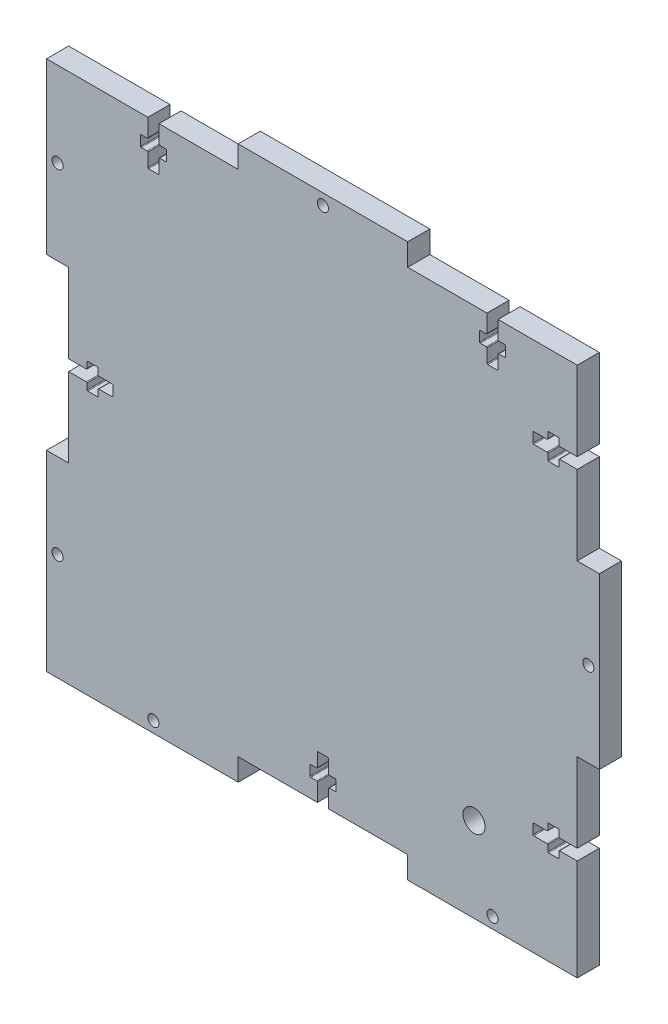
from build123d import *

# Parameters (mm, degrees)
BOX_SIDE_DEPTH       = 6
SKETCH2_R            = 1.5
SCREW_CUT_OUTS_DEPTH = 107.235587258
SKETCH3_R            = 3
CUT_EXTRUDE1_DEPTH   = 107.235587258


with BuildPart() as part:
    # Sketch1 → Box Side (new body)
    with BuildSketch(Plane.XY):
        Polygon((-69, 69), (-23, 69), (-23, 75), (23, 75), (23, 69), (69, 69), (69, 23), (75, 23), (75, -23), (69, -23), (69, -69), (69, -75), (23, -75), (23, -69), (-23, -69), (-23, -75), (-69, -75), (-75, -75), (-75, -69), (-75, -23), (-69, -23), (-69, 23), (-75, 23), (-75, 69), align=None)
    extrude(amount=BOX_SIDE_DEPTH)

    # Sketch2 → Screw Cut-outs (cut, through all)
    with BuildSketch(Plane.XY.offset(6)):
        with Locations((0, 72)):
            Circle(SKETCH2_R)
        with Locations((72, 0)):
            Circle(SKETCH2_R)
        with Locations((-46, -72)):
            Circle(SKETCH2_R)
        with Locations((46, -72)):
            Circle(SKETCH2_R)
        with Locations((-72, 46)):
            Circle(SKETCH2_R)
        with Locations((-72, -46)):
            Circle(SKETCH2_R)
        with BuildLine():
            Line((-44.5, 69), (-44.5, 64.2))
            ThreePointArc((-44.5, 64.2), (-44.441421356, 64.058578644), (-44.3, 64))
            Line((-44.3, 64), (-42.7, 64))
            ThreePointArc((-42.7, 64), (-42.558578644, 63.941421356), (-42.5, 63.8))
            Line((-42.5, 63.8), (-42.5, 61.2))
            ThreePointArc((-42.5, 61.2), (-42.558578644, 61.058578644), (-42.7, 61))
            Line((-42.7, 61), (-44.3, 61))
            ThreePointArc((-44.3, 61), (-44.441421356, 60.941421356), (-44.5, 60.8))
            Line((-44.5, 60.8), (-44.5, 57.2))
            ThreePointArc((-44.5, 57.2), (-44.558578644, 57.058578644), (-44.7, 57))
            Line((-44.7, 57), (-47.3, 57))
            ThreePointArc((-47.3, 57), (-47.441421356, 57.058578644), (-47.5, 57.2))
            Line((-47.5, 57.2), (-47.5, 60.8))
            ThreePointArc((-47.5, 60.8), (-47.558578644, 60.941421356), (-47.7, 61))
            Line((-47.7, 61), (-49.3, 61))
            ThreePointArc((-49.3, 61), (-49.441421356, 61.058578644), (-49.5, 61.2))
            Line((-49.5, 61.2), (-49.5, 63.8))
            ThreePointArc((-49.5, 63.8), (-49.441421356, 63.941421356), (-49.3, 64))
            Line((-49.3, 64), (-47.7, 64))
            ThreePointArc((-47.7, 64), (-47.558578644, 64.058578644), (-47.5, 64.2))
            Line((-47.5, 64.2), (-47.5, 69))
            Line((-47.5, 69), (-44.5, 69))
        make_face()
        with BuildLine():
            Line((47.5, 69), (47.5, 64.2))
            ThreePointArc((47.5, 64.2), (47.558578644, 64.058578644), (47.7, 64))
            Line((47.7, 64), (49.3, 64))
            ThreePointArc((49.3, 64), (49.441421356, 63.941421356), (49.5, 63.8))
            Line((49.5, 63.8), (49.5, 61.2))
            ThreePointArc((49.5, 61.2), (49.441421356, 61.058578644), (49.3, 61))
            Line((49.3, 61), (47.7, 61))
            ThreePointArc((47.7, 61), (47.558578644, 60.941421356), (47.5, 60.8))
            Line((47.5, 60.8), (47.5, 57.2))
            ThreePointArc((47.5, 57.2), (47.441421356, 57.058578644), (47.3, 57))
            Line((47.3, 57), (44.7, 57))
            ThreePointArc((44.7, 57), (44.558578644, 57.058578644), (44.5, 57.2))
            Line((44.5, 57.2), (44.5, 60.8))
            ThreePointArc((44.5, 60.8), (44.441421356, 60.941421356), (44.3, 61))
            Line((44.3, 61), (42.7, 61))
            ThreePointArc((42.7, 61), (42.558578644, 61.058578644), (42.5, 61.2))
            Line((42.5, 61.2), (42.5, 63.8))
            ThreePointArc((42.5, 63.8), (42.558578644, 63.941421356), (42.7, 64))
            Line((42.7, 64), (44.3, 64))
            ThreePointArc((44.3, 64), (44.441421356, 64.058578644), (44.5, 64.2))
            Line((44.5, 64.2), (44.5, 69))
            Line((44.5, 69), (47.5, 69))
        make_face()
        with BuildLine():
            Line((69, 44.5), (64.2, 44.5))
            ThreePointArc((64.2, 44.5), (64.058578644, 44.441421356), (64, 44.3))
            Line((64, 44.3), (64, 42.7))
            ThreePointArc((64, 42.7), (63.941421356, 42.558578644), (63.8, 42.5))
            Line((63.8, 42.5), (61.2, 42.5))
            ThreePointArc((61.2, 42.5), (61.058578644, 42.558578644), (61, 42.7))
            Line((61, 42.7), (61, 44.3))
            ThreePointArc((61, 44.3), (60.941421356, 44.441421356), (60.8, 44.5))
            Line((60.8, 44.5), (57.2, 44.5))
            ThreePointArc((57.2, 44.5), (57.058578644, 44.558578644), (57, 44.7))
            Line((57, 44.7), (57, 47.3))
            ThreePointArc((57, 47.3), (57.058578644, 47.441421356), (57.2, 47.5))
            Line((57.2, 47.5), (60.8, 47.5))
            ThreePointArc((60.8, 47.5), (60.941421356, 47.558578644), (61, 47.7))
            Line((61, 47.7), (61, 49.3))
            ThreePointArc((61, 49.3), (61.058578644, 49.441421356), (61.2, 49.5))
            Line((61.2, 49.5), (63.8, 49.5))
            ThreePointArc((63.8, 49.5), (63.941421356, 49.441421356), (64, 49.3))
            Line((64, 49.3), (64, 47.7))
            ThreePointArc((64, 47.7), (64.058578644, 47.558578644), (64.2, 47.5))
            Line((64.2, 47.5), (69, 47.5))
            Line((69, 47.5), (69, 44.5))
        make_face()
        with BuildLine():
            Line((69, -47.5), (64.2, -47.5))
            ThreePointArc((64.2, -47.5), (64.058578644, -47.558578644), (64, -47.7))
            Line((64, -47.7), (64, -49.3))
            ThreePointArc((64, -49.3), (63.941421356, -49.441421356), (63.8, -49.5))
            Line((63.8, -49.5), (61.2, -49.5))
            ThreePointArc((61.2, -49.5), (61.058578644, -49.441421356), (61, -49.3))
            Line((61, -49.3), (61, -47.7))
            ThreePointArc((61, -47.7), (60.941421356, -47.558578644), (60.8, -47.5))
            Line((60.8, -47.5), (57.2, -47.5))
            ThreePointArc((57.2, -47.5), (57.058578644, -47.441421356), (57, -47.3))
            Line((57, -47.3), (57, -44.7))
            ThreePointArc((57, -44.7), (57.058578644, -44.558578644), (57.2, -44.5))
            Line((57.2, -44.5), (60.8, -44.5))
            ThreePointArc((60.8, -44.5), (60.941421356, -44.441421356), (61, -44.3))
            Line((61, -44.3), (61, -42.7))
            ThreePointArc((61, -42.7), (61.058578644, -42.558578644), (61.2, -42.5))
            Line((61.2, -42.5), (63.8, -42.5))
            ThreePointArc((63.8, -42.5), (63.941421356, -42.558578644), (64, -42.7))
            Line((64, -42.7), (64, -44.3))
            ThreePointArc((64, -44.3), (64.058578644, -44.441421356), (64.2, -44.5))
            Line((64.2, -44.5), (69, -44.5))
            Line((69, -44.5), (69, -47.5))
        make_face()
        with BuildLine():
            Line((-1.5, -69), (1.5, -69))
            Line((1.5, -69), (1.5, -64.2))
            ThreePointArc((1.5, -64.2), (1.558578644, -64.058578644), (1.7, -64))
            Line((1.7, -64), (3.3, -64))
            ThreePointArc((3.3, -64), (3.441421356, -63.941421356), (3.5, -63.8))
            Line((3.5, -63.8), (3.5, -61.2))
            ThreePointArc((3.5, -61.2), (3.441421356, -61.058578644), (3.3, -61))
            Line((3.3, -61), (1.7, -61))
            ThreePointArc((1.7, -61), (1.558578644, -60.941421356), (1.5, -60.8))
            Line((1.5, -60.8), (1.5, -57.2))
            ThreePointArc((1.5, -57.2), (1.441421356, -57.058578644), (1.3, -57))
            Line((1.3, -57), (-1.3, -57))
            ThreePointArc((-1.3, -57), (-1.441421356, -57.058578644), (-1.5, -57.2))
            Line((-1.5, -57.2), (-1.5, -60.8))
            ThreePointArc((-1.5, -60.8), (-1.558578644, -60.941421356), (-1.7, -61))
            Line((-1.7, -61), (-3.3, -61))
            ThreePointArc((-3.3, -61), (-3.441421356, -61.058578644), (-3.5, -61.2))
            Line((-3.5, -61.2), (-3.5, -63.8))
            ThreePointArc((-3.5, -63.8), (-3.441421356, -63.941421356), (-3.3, -64))
            Line((-3.3, -64), (-1.7, -64))
            ThreePointArc((-1.7, -64), (-1.558578644, -64.058578644), (-1.5, -64.2))
            Line((-1.5, -64.2), (-1.5, -69))
        make_face()
        with BuildLine():
            Line((-69, -1.5), (-64.2, -1.5))
            ThreePointArc((-64.2, -1.5), (-64.058578644, -1.558578644), (-64, -1.7))
            Line((-64, -1.7), (-64, -3.3))
            ThreePointArc((-64, -3.3), (-63.941421356, -3.441421356), (-63.8, -3.5))
            Line((-63.8, -3.5), (-61.2, -3.5))
            ThreePointArc((-61.2, -3.5), (-61.058578644, -3.441421356), (-61, -3.3))
            Line((-61, -3.3), (-61, -1.7))
            ThreePointArc((-61, -1.7), (-60.941421356, -1.558578644), (-60.8, -1.5))
            Line((-60.8, -1.5), (-57.2, -1.5))
            ThreePointArc((-57.2, -1.5), (-57.058578644, -1.441421356), (-57, -1.3))
            Line((-57, -1.3), (-57, 1.3))
            ThreePointArc((-57, 1.3), (-57.058578644, 1.441421356), (-57.2, 1.5))
            Line((-57.2, 1.5), (-60.8, 1.5))
            ThreePointArc((-60.8, 1.5), (-60.941421356, 1.558578644), (-61, 1.7))
            Line((-61, 1.7), (-61, 3.3))
            ThreePointArc((-61, 3.3), (-61.058578644, 3.441421356), (-61.2, 3.5))
            Line((-61.2, 3.5), (-63.8, 3.5))
            ThreePointArc((-63.8, 3.5), (-63.941421356, 3.441421356), (-64, 3.3))
            Line((-64, 3.3), (-64, 1.7))
            ThreePointArc((-64, 1.7), (-64.058578644, 1.558578644), (-64.2, 1.5))
            Line((-64.2, 1.5), (-69, 1.5))
            Line((-69, 1.5), (-69, -1.5))
        make_face()
    extrude(amount=-SCREW_CUT_OUTS_DEPTH, mode=Mode.SUBTRACT)

    # Sketch3 → Cut-Extrude1 (cut, through all)
    with BuildSketch(Plane.XY.offset(6)):
        with Locations((41, -52)):
            Circle(SKETCH3_R)
    extrude(amount=-CUT_EXTRUDE1_DEPTH, mode=Mode.SUBTRACT)


solid = part.part
